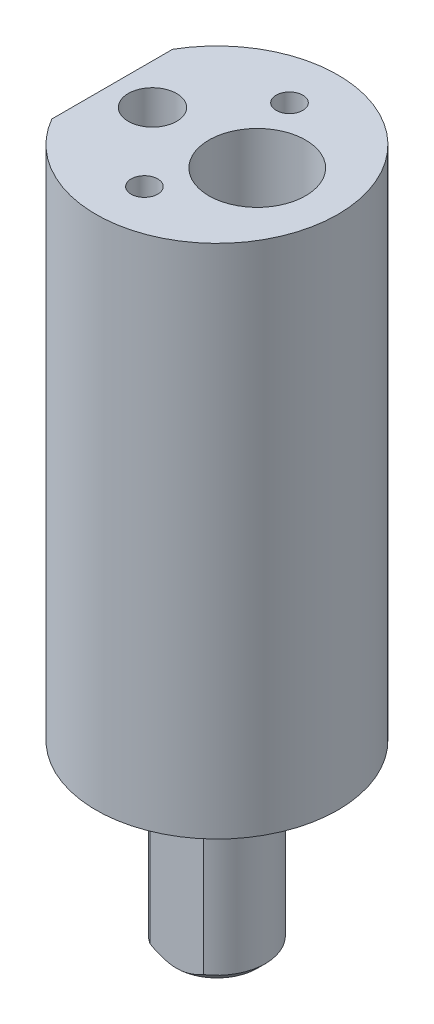
from build123d import *

# Parameters (mm, degrees)
BOSS_EXTRUDE2_DEPTH   = 22
BOSS_EXTRUDE3_DEPTH   = 64
SKETCH3_R             = 3
CUT_EXTRUDE1_DEPTH    = 65
SKETCH4_R             = 6
CUT_EXTRUDE2_DEPTH    = 52
M4_TAPPED_HOLE1_D     = 3.3
M4_TAPPED_HOLE1_DEPTH = 14
M4_TAPPED_HOLE1_TIP   = 0.991420021
SKETCH8_R             = 2.5
SKETCH8_R_2           = 1.5
CUT_EXTRUDE3_DEPTH    = 5
SKETCH9_R             = 1
CUT_EXTRUDE4_DEPTH    = 15
CHAMFER1_SIZE         = 1


with BuildPart() as part:
    # Sketch1 → Boss-Extrude2 (new body)
    with BuildSketch(Plane(origin=(0, 0, 0), x_dir=(1, 0, 0), z_dir=(0, 1, 0))):
        with BuildLine():
            Line((-3.31662479, -5), (3.31662479, -5))
            ThreePointArc((3.31662479, -5), (0, 6), (-3.31662479, -5))
        make_face()
    extrude(amount=BOSS_EXTRUDE2_DEPTH)

    # Sketch2 → Boss-Extrude3 (add)
    with BuildSketch(Plane(origin=(0, 22, 0), x_dir=(1, 0, 0), z_dir=(0, 1, 0))):
        with BuildLine():
            Line((-13, 7.483314774), (-13, -7.483314774))
            ThreePointArc((-13, -7.483314774), (15, 0), (-13, 7.483314774))
        make_face()
    extrude(amount=BOSS_EXTRUDE3_DEPTH)

    # Sketch3 → Cut-Extrude1 (cut)
    with BuildSketch(Plane(origin=(0, 86, 0), x_dir=(1, 0, 0), z_dir=(0, 1, 0))):
        with Locations(Location((-8, 0, 0), (0, 0, 270))):
            Circle(SKETCH3_R)
    extrude(amount=-CUT_EXTRUDE1_DEPTH, mode=Mode.SUBTRACT)

    # Sketch4 → Cut-Extrude2 (cut)
    with BuildSketch(Plane(origin=(0, 86, 0), x_dir=(1, 0, 0), z_dir=(0, 1, 0))):
        with Locations(Location((5, 0, 0), (0, 0, 270))):
            Circle(SKETCH4_R)
    extrude(amount=-CUT_EXTRUDE2_DEPTH, mode=Mode.SUBTRACT)

    # M4 Tapped Hole1
    with Locations(Plane(origin=(0, 86, 0), x_dir=(1, 0, 0), z_dir=(0, 1, 0))):
        with Locations((0, -9), (0, 9)):
            Hole(M4_TAPPED_HOLE1_D / 2, depth=M4_TAPPED_HOLE1_DEPTH)
            with Locations((0, 0, -(M4_TAPPED_HOLE1_DEPTH + M4_TAPPED_HOLE1_TIP / 2))):  # 118° drill point
                Cone(0, M4_TAPPED_HOLE1_D / 2, M4_TAPPED_HOLE1_TIP, mode=Mode.SUBTRACT)

    # Sketch8 → Cut-Extrude3 (cut)
    with BuildSketch(Plane.ZY.offset(13)):
        with Locations((0, 54)):
            Circle(SKETCH8_R)
        with Locations((0, 25)):
            Circle(SKETCH8_R_2)
    extrude(amount=-CUT_EXTRUDE3_DEPTH, mode=Mode.SUBTRACT)

    # Sketch9 → Cut-Extrude4 (cut)
    with BuildSketch(Plane.ZY.offset(13)):
        with Locations((0, 76)):
            Circle(SKETCH9_R)
        with Locations((0, 34)):
            Circle(SKETCH9_R)
    extrude(amount=-CUT_EXTRUDE4_DEPTH, mode=Mode.SUBTRACT)

    # Chamfer1
    chamfer1_edges = [part.edges().sort_by_distance(p)[0] for p in [
        (0, 0, -6),
    ]]
    chamfer(chamfer1_edges, length=CHAMFER1_SIZE - 0.0001)  # a hair under: the kernel refuses the full size


solid = part.part
